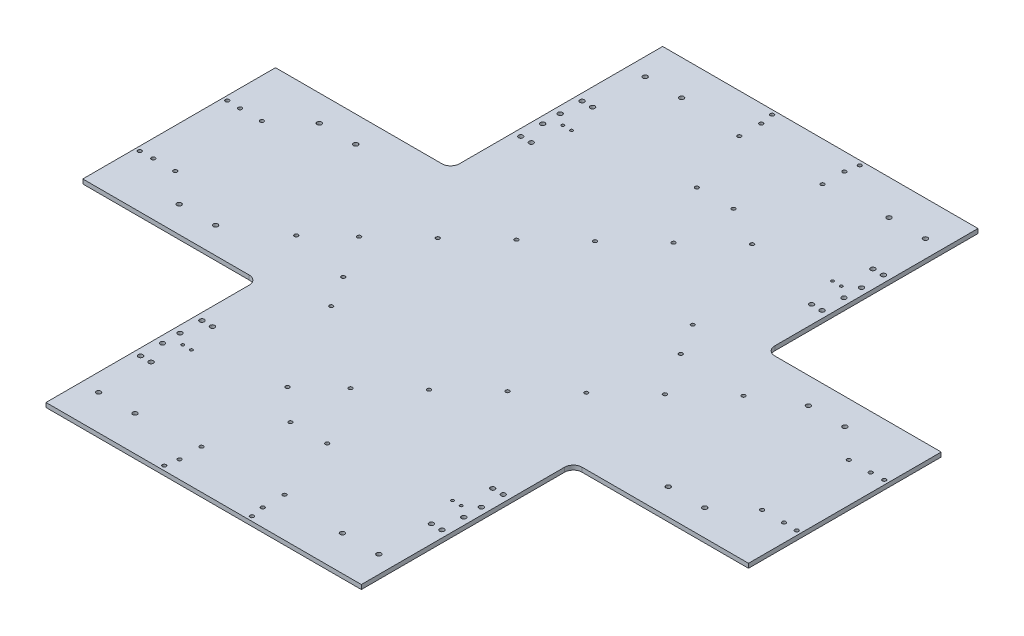
from build123d import *

# Parameters (mm, degrees)
BOSS_EXTRUDE1_DEPTH = 5
SKETCH2_R           = 2.125
CUT_EXTRUDE1_DEPTH  = 3
SKETCH4_R           = 2.6
SKETCH4_R_2         = 1.6
CUT_EXTRUDE3_DEPTH  = 10
SKETCH5_R           = 2.125
CUT_EXTRUDE4_DEPTH  = 10
FILLET1_R           = 10
SKETCH6_R           = 2.6
CUT_EXTRUDE5_DEPTH  = 10
SKETCH7_R           = 2.125
CUT_EXTRUDE6_DEPTH  = 10
SKETCH9_R           = 2.1
CUT_EXTRUDE7_DEPTH  = 10


with BuildPart() as part:
    # Sketch1 → Boss-Extrude1 (new body)
    with BuildSketch(Plane(origin=(0, 0, 0), x_dir=(1, 0, 0), z_dir=(0, 1, 0))):
        Polygon((180, 352), (-180, 352), (-180, 110), (-380, 110), (-380, -110), (-180, -110), (-180, -352), (180, -352), (180, -110), (380, -110), (380, 110), (180, 110), align=None)
    extrude(amount=BOSS_EXTRUDE1_DEPTH)

    # Sketch2 → Cut-Extrude1 (cut)
    with BuildSketch(Plane(origin=(0, 5, 0), x_dir=(1, 0, 0), z_dir=(0, 1, 0))):
        with Locations((360, 49.5)):
            Circle(SKETCH2_R)
        with Locations((335, 49.5)):
            Circle(SKETCH2_R)
        with Locations((335, -49.5)):
            Circle(SKETCH2_R)
        with Locations((360, -49.5)):
            Circle(SKETCH2_R)
        with Locations((-360, -49.5)):
            Circle(SKETCH2_R)
        with Locations((-335, -49.5)):
            Circle(SKETCH2_R)
        with Locations((-335, 49.5)):
            Circle(SKETCH2_R)
        with Locations((-360, 49.5)):
            Circle(SKETCH2_R)
        with Locations((47.5, 332)):
            Circle(SKETCH2_R)
        with Locations((47.5, 307)):
            Circle(SKETCH2_R)
        with Locations((-47.5, 307)):
            Circle(SKETCH2_R)
        with Locations((-47.5, 332)):
            Circle(SKETCH2_R)
        with Locations((-47.5, -332)):
            Circle(SKETCH2_R)
        with Locations((-47.5, -307)):
            Circle(SKETCH2_R)
        with Locations((47.5, -307)):
            Circle(SKETCH2_R)
        with Locations((47.5, -332)):
            Circle(SKETCH2_R)
    extrude(amount=-CUT_EXTRUDE1_DEPTH, mode=Mode.SUBTRACT)

    # Sketch4 → Cut-Extrude3 (cut)
    with BuildSketch(Plane(origin=(0, 5, 0), x_dir=(1, 0, 0), z_dir=(0, 1, 0))):
        with Locations((-172, 182)):
            Circle(SKETCH4_R)
        with Locations((-160, 182)):
            Circle(SKETCH4_R)
        with Locations((-172, 207)):
            Circle(SKETCH4_R)
        with Locations((-172, 227)):
            Circle(SKETCH4_R)
        with Locations((-172, 252)):
            Circle(SKETCH4_R)
        with Locations((-160, 252)):
            Circle(SKETCH4_R)
        with Locations((160, 252)):
            Circle(SKETCH4_R)
        with Locations((172, 252)):
            Circle(SKETCH4_R)
        with Locations((172, 227)):
            Circle(SKETCH4_R)
        with Locations((172, 207)):
            Circle(SKETCH4_R)
        with Locations((160, 182)):
            Circle(SKETCH4_R)
        with Locations((172, 182)):
            Circle(SKETCH4_R)
        with Locations((172, -182)):
            Circle(SKETCH4_R)
        with Locations((160, -182)):
            Circle(SKETCH4_R)
        with Locations((172, -207)):
            Circle(SKETCH4_R)
        with Locations((172, -227)):
            Circle(SKETCH4_R)
        with Locations((172, -252)):
            Circle(SKETCH4_R)
        with Locations((160, -252)):
            Circle(SKETCH4_R)
        with Locations((-160, -252)):
            Circle(SKETCH4_R)
        with Locations((-172, -252)):
            Circle(SKETCH4_R)
        with Locations((-172, -227)):
            Circle(SKETCH4_R)
        with Locations((-172, -207)):
            Circle(SKETCH4_R)
        with Locations((-160, -182)):
            Circle(SKETCH4_R)
        with Locations((-172, -182)):
            Circle(SKETCH4_R)
        with Locations((159, -217)):
            Circle(SKETCH4_R_2)
        with Locations((-159, -217)):
            Circle(SKETCH4_R_2)
        with Locations((159, 217)):
            Circle(SKETCH4_R_2)
        with Locations((-159, 217)):
            Circle(SKETCH4_R_2)
        with Locations((149, -217)):
            Circle(SKETCH4_R_2)
        with Locations((-149, -217)):
            Circle(SKETCH4_R_2)
        with Locations((149, 217)):
            Circle(SKETCH4_R_2)
        with Locations((-149, 217)):
            Circle(SKETCH4_R_2)
    extrude(amount=-CUT_EXTRUDE3_DEPTH, mode=Mode.SUBTRACT)

    # Sketch5 → Cut-Extrude4 (cut)
    with BuildSketch(Plane(origin=(0, 5, 0), x_dir=(1, 0, 0), z_dir=(0, 1, 0))):
        with Locations((-50, 347)):
            Circle(SKETCH5_R)
        with Locations((50, 347)):
            Circle(SKETCH5_R)
        with Locations((50, -347)):
            Circle(SKETCH5_R)
        with Locations((-50, -347)):
            Circle(SKETCH5_R)
        with Locations((-375, 50)):
            Circle(SKETCH5_R)
        with Locations((-375, -50)):
            Circle(SKETCH5_R)
        with Locations((375, -50)):
            Circle(SKETCH5_R)
        with Locations((375, 50)):
            Circle(SKETCH5_R)
    extrude(amount=-CUT_EXTRUDE4_DEPTH, mode=Mode.SUBTRACT)

    # Fillet1
    fillet1_edges = [part.edges().sort_by_distance(p)[0] for p in [
        (-180, 2.5, -110),
        (-180, 2.5, 110),
        (180, 2.5, 110),
        (180, 2.5, -110),
    ]]
    fillet(fillet1_edges, radius=FILLET1_R)

    # Sketch6 → Cut-Extrude5 (cut)
    with BuildSketch(Plane(origin=(0, 5, 0), x_dir=(1, 0, 0), z_dir=(0, 1, 0))):
        with Locations((-160, 312)):
            Circle(SKETCH6_R)
        with Locations((-118.4, 312)):
            Circle(SKETCH6_R)
        with Locations((118.4, 312)):
            Circle(SKETCH6_R)
        with Locations((160, 312)):
            Circle(SKETCH6_R)
        with Locations((160, -312)):
            Circle(SKETCH6_R)
        with Locations((118.4, -312)):
            Circle(SKETCH6_R)
        with Locations((-118.4, -312)):
            Circle(SKETCH6_R)
        with Locations((-160, -312)):
            Circle(SKETCH6_R)
        with Locations((258.4, 80)):
            Circle(SKETCH6_R)
        with Locations((300, 80)):
            Circle(SKETCH6_R)
        with Locations((300, -80)):
            Circle(SKETCH6_R)
        with Locations((258.4, -80)):
            Circle(SKETCH6_R)
        with Locations((-258.4, -80)):
            Circle(SKETCH6_R)
        with Locations((-300, -80)):
            Circle(SKETCH6_R)
        with Locations((-300, 80)):
            Circle(SKETCH6_R)
        with Locations((-258.4, 80)):
            Circle(SKETCH6_R)
    extrude(amount=-CUT_EXTRUDE5_DEPTH, mode=Mode.SUBTRACT)

    # Sketch7 → Cut-Extrude6 (cut)
    with BuildSketch(Plane(origin=(0, 5, 0), x_dir=(1, 0, 0), z_dir=(0, 1, 0))):
        with Locations((-72.423012394, 77.400951388)):
            Circle(SKETCH7_R)
        with Locations((-26.055461327, 120.786435228)):
            Circle(SKETCH7_R)
        with Locations((20.31208974, 164.171919068)):
            Circle(SKETCH7_R)
        with Locations((66.679640807, 207.557402908)):
            Circle(SKETCH7_R)
        with Locations((-118.790563461, 34.015467548)):
            Circle(SKETCH7_R)
        with Locations((-165.158114529, -9.370016292)):
            Circle(SKETCH7_R)
        with Locations((-202.252155383, -44.078403364)):
            Circle(SKETCH7_R)
        with Locations((-57.406130594, -198.88030614)):
            Circle(SKETCH7_R)
        with Locations((-20.31208974, -164.171919068)):
            Circle(SKETCH7_R)
        with Locations((26.055461327, -120.786435228)):
            Circle(SKETCH7_R)
        with Locations((211.525665596, 52.755500132)):
            Circle(SKETCH7_R)
        with Locations((165.158114529, 9.370016292)):
            Circle(SKETCH7_R)
        with Locations((118.790563461, -34.015467548)):
            Circle(SKETCH7_R)
        with Locations((72.423012394, -77.400951388)):
            Circle(SKETCH7_R)
    extrude(amount=-CUT_EXTRUDE6_DEPTH, mode=Mode.SUBTRACT)

    # Sketch9 → Cut-Extrude7 (cut)
    with BuildSketch(Plane(origin=(0, 5, 0), x_dir=(1, 0, 0), z_dir=(0, 1, 0))):
        with Locations((-134.396185529, -58.288539604)):
            Circle(SKETCH9_R)
        with Locations((-112.333487225, -94.026997091)):
            Circle(SKETCH9_R)
        with Locations((112.333487225, 94.026997091)):
            Circle(SKETCH9_R)
        with Locations((134.396185529, 58.288539604)):
            Circle(SKETCH9_R)
        with Locations((21, 232)):
            Circle(SKETCH9_R)
        with Locations((-21, 232)):
            Circle(SKETCH9_R)
        with Locations((-21, -232)):
            Circle(SKETCH9_R)
        with Locations((21, -232)):
            Circle(SKETCH9_R)
    extrude(amount=-CUT_EXTRUDE7_DEPTH, mode=Mode.SUBTRACT)


solid = part.part
